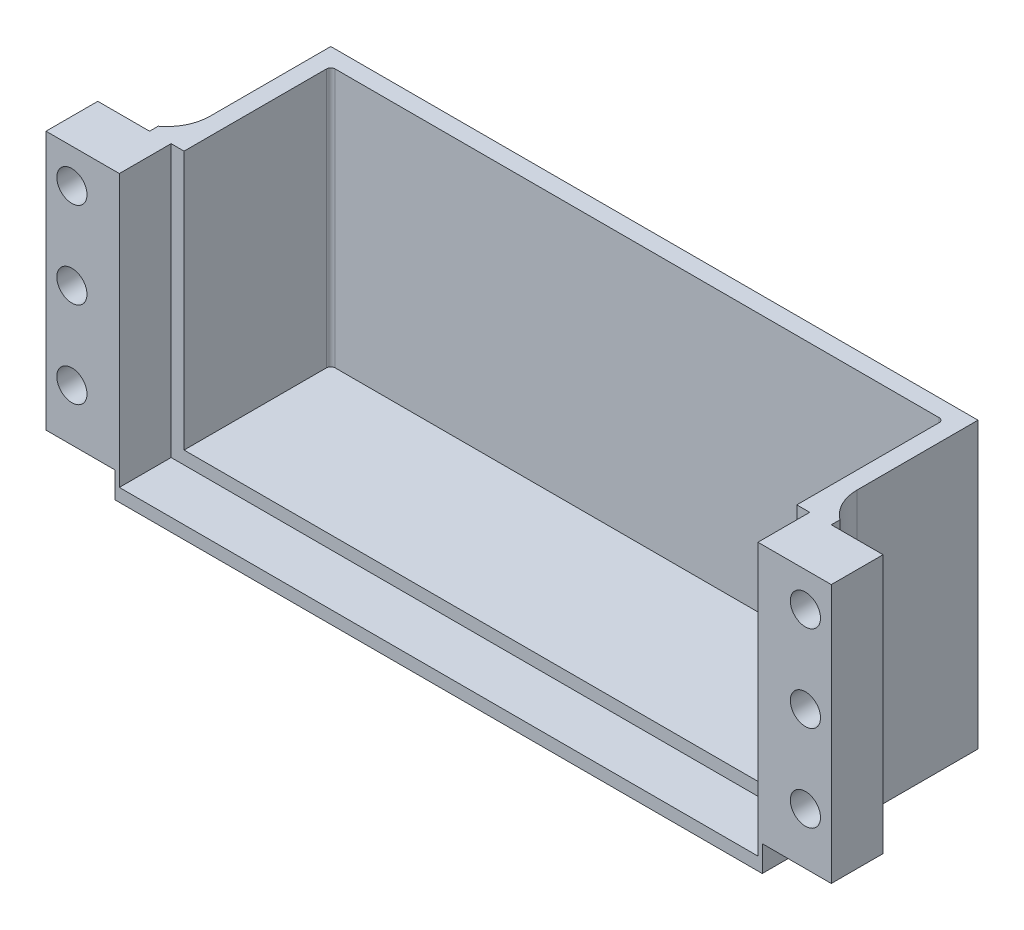
from build123d import *

# Parameters (mm, degrees)
SKETCH2_W           = 75
SKETCH2_H           = 25
BOSS_EXTRUDE1_DEPTH = 3
BOSS_EXTRUDE2_DEPTH = 30
SKETCH5_W           = 6
SKETCH5_H           = 30
BOSS_EXTRUDE3_DEPTH = 8
SKETCH6_W           = 6
SKETCH6_H           = 30
BOSS_EXTRUDE4_DEPTH = 8
SKETCH8_R           = 1.75
CUT_EXTRUDE1_DEPTH  = 8
CUT_EXTRUDE2_DEPTH  = 6
FILLET1_R           = 5
FILLET2_R           = 5
SKETCH13_W          = 6
SKETCH13_H          = 2
CUT_EXTRUDE3_DEPTH  = 36
FILLET3_R           = 0.5


with BuildPart() as part:
    # Sketch2 → Boss-Extrude1 (new body)
    with BuildSketch(Plane(origin=(0, 0, 0), x_dir=(1, 0, 0), z_dir=(0, 1, 0))):
        with Locations((0, 12.5)):
            Rectangle(SKETCH2_W, SKETCH2_H)
    extrude(amount=BOSS_EXTRUDE1_DEPTH)

    # Sketch3 → Boss-Extrude2 (add)
    with BuildSketch(Plane(origin=(0, 3, 0), x_dir=(1, 0, 0), z_dir=(0, 1, 0))):
        Polygon((-35.5, 0), (-35.5, 23), (35.5, 23), (35.5, 0), (37.5, 0), (37.5, 25), (-37.5, 25), (-37.5, 0), align=None)
    extrude(amount=BOSS_EXTRUDE2_DEPTH)

    # Sketch5 → Boss-Extrude3 (add)
    with BuildSketch(Plane.ZY.offset(37.5)):
        with Locations((-3, 18)):
            Rectangle(SKETCH5_W, SKETCH5_H)
    extrude(amount=BOSS_EXTRUDE3_DEPTH)

    # Sketch6 → Boss-Extrude4 (add)
    with BuildSketch(Plane(origin=(37.5, 0, 0), x_dir=(0, 0, -1), z_dir=(1, 0, 0))):
        with Locations((3, 18)):
            Rectangle(SKETCH6_W, SKETCH6_H)
    extrude(amount=BOSS_EXTRUDE4_DEPTH)

    # Sketch8 → Cut-Extrude1 (cut)
    with BuildSketch(Plane.XY):
        with Locations((-42.5, 29)):
            Circle(SKETCH8_R)
        with Locations((42.5, 29)):
            Circle(SKETCH8_R)
        with Locations((-42.5, 19)):
            Circle(SKETCH8_R)
        with Locations((-42.5, 9)):
            Circle(SKETCH8_R)
        with Locations((42.5, 19)):
            Circle(SKETCH8_R)
        with Locations((42.5, 9)):
            Circle(SKETCH8_R)
    extrude(amount=-CUT_EXTRUDE1_DEPTH, mode=Mode.SUBTRACT)

    # Sketch12 → Cut-Extrude2 (cut)
    with BuildSketch(Plane.XY):
        Polygon((-35.5, 33), (-37, 33), (-37, 1.5), (37, 1.5), (37, 33), (35.5, 33), (35.5, 3), (-35.5, 3), align=None)
    extrude(amount=-CUT_EXTRUDE2_DEPTH, mode=Mode.SUBTRACT)

    # Fillet1
    # the kernel refuses this fillet: 5 mm, written as the material it adds along each edge
    with BuildSketch(Plane(origin=(-37.5, 33, -6), x_dir=(0, 0, -1), z_dir=(0, -1, 0))) as fillet1_piece_1_section:
        with BuildLine():
            CenterArc((FILLET1_R, -FILLET1_R), FILLET1_R, 90, 90)
            Line((0, -FILLET1_R), (0, 0))
            Line((0, 0), (FILLET1_R, 0))
        make_face()
    fillet1_piece_1 = extrude(amount=30, mode=Mode.PRIVATE)
    fillet1_piece_1 = fillet1_piece_1 - Plane(origin=(-42.5, 29, -7.147283254), x_dir=(1, 0, 0), z_dir=(0, 0, 1)) * Cylinder(1.75, 80, mode=Mode.PRIVATE)
    fillet1_piece_1 = fillet1_piece_1 - Plane(origin=(-42.5, 19, -7.147283254), x_dir=(1, 0, 0), z_dir=(0, 0, 1)) * Cylinder(1.75, 80, mode=Mode.PRIVATE)
    fillet1_piece_1 = fillet1_piece_1 - Plane(origin=(-42.5, 9, -7.147283254), x_dir=(1, 0, 0), z_dir=(0, 0, 1)) * Cylinder(1.75, 80, mode=Mode.PRIVATE)
    add(fillet1_piece_1)

    # Fillet2
    # the kernel refuses this fillet: 5 mm, written as the material it adds along each edge
    with BuildSketch(Plane(origin=(37.5, 33, -6), x_dir=(1, 0, 0), z_dir=(0, -1, 0))) as fillet2_piece_1_section:
        with BuildLine():
            CenterArc((FILLET2_R, -FILLET2_R), FILLET2_R, 90, 90)
            Line((0, -FILLET2_R), (0, 0))
            Line((0, 0), (FILLET2_R, 0))
        make_face()
    fillet2_piece_1 = extrude(amount=30, mode=Mode.PRIVATE)
    fillet2_piece_1 = fillet2_piece_1 - Plane(origin=(42.5, 9, -7.147283906), x_dir=(1, 0, 0), z_dir=(0, 0, 1)) * Cylinder(1.75, 80, mode=Mode.PRIVATE)
    fillet2_piece_1 = fillet2_piece_1 - Plane(origin=(42.5, 29, -7.147283906), x_dir=(1, 0, 0), z_dir=(0, 0, 1)) * Cylinder(1.75, 80, mode=Mode.PRIVATE)
    fillet2_piece_1 = fillet2_piece_1 - Plane(origin=(42.5, 19, -7.147283906), x_dir=(1, 0, 0), z_dir=(0, 0, 1)) * Cylinder(1.75, 80, mode=Mode.PRIVATE)
    add(fillet2_piece_1)

    # Sketch13 → Cut-Extrude3 (cut)
    with BuildSketch(Plane(origin=(0, 33, 0), x_dir=(1, 0, 0), z_dir=(0, 1, 0))):
        with Locations((-42.5, 7)):
            Rectangle(SKETCH13_W, SKETCH13_H)
        with Locations((42.5, 7)):
            Rectangle(SKETCH13_W, SKETCH13_H)
    extrude(amount=-CUT_EXTRUDE3_DEPTH, mode=Mode.SUBTRACT)

    # Fillet3
    fillet3_edges = [part.edges().sort_by_distance(p)[0] for p in [
        (-35.5, 18, -23),
        (35.5, 18, -23),
    ]]
    fillet(fillet3_edges, radius=FILLET3_R)


solid = part.part
